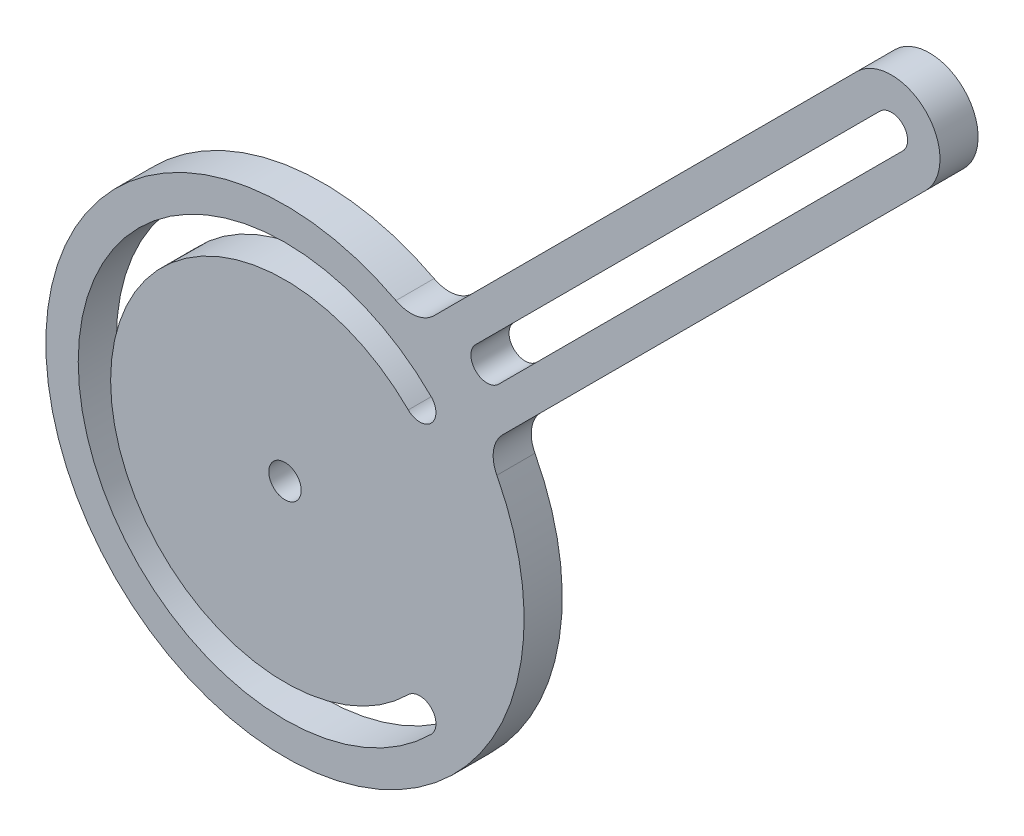
from build123d import *

# Parameters (mm, degrees)
SKETCH1_R           = 31.877
SKETCH1_R_2         = 2.159
BOSS_EXTRUDE1_DEPTH = 5.08
BOSS_EXTRUDE4_START = -5.08
BOSS_EXTRUDE4_DEPTH = 5.08
FILLET1_R           = 4.318


with BuildPart() as part:
    # Sketch1 → Boss-Extrude1 (new body)
    with BuildSketch(Plane.XY):
        Circle(SKETCH1_R)
        Circle(SKETCH1_R_2, mode=Mode.SUBTRACT)
        with BuildLine():
            ThreePointArc((19.487155783, 19.487155783), (-27.559, 0), (19.487155783, -19.487155783))
            ThreePointArc((19.487155783, -19.487155783), (19.487155783, -16.433868702), (16.433868702, -16.433868702))
            ThreePointArc((16.433868702, -16.433868702), (-23.241, 0), (16.433868702, 16.433868702))
            ThreePointArc((16.433868702, 16.433868702), (19.487155783, 16.433868702), (19.487155783, 19.487155783))
        make_face(mode=Mode.SUBTRACT)
    extrude(amount=BOSS_EXTRUDE1_DEPTH)

    # Sketch2 → Boss-Extrude4 (add)
    with BuildSketch(Plane.XY.offset(5.08).offset(BOSS_EXTRUDE4_START)):
        with BuildLine():
            Line((76.242374468, 85.402235711), (17.490316318, 26.650177562))
            ThreePointArc((17.490316318, 26.650177562), (22.540442864, 22.540442864), (26.650177562, 17.490316318))
            Line((26.650177562, 17.490316318), (85.402235711, 76.242374468))
            ThreePointArc((85.402235711, 76.242374468), (85.402235711, 85.402235711), (76.242374468, 85.402235711))
        make_face()
        with BuildLine():
            ThreePointArc((28.467411904, 25.414124823), (25.414124823, 25.414124823), (25.414124823, 28.467411904))
            Line((25.414124823, 28.467411904), (79.295661549, 82.34894863))
            ThreePointArc((79.295661549, 82.34894863), (82.34894863, 82.34894863), (82.34894863, 79.295661549))
            Line((82.34894863, 79.295661549), (28.467411904, 25.414124823))
        make_face(mode=Mode.SUBTRACT)
    extrude(amount=BOSS_EXTRUDE4_DEPTH)

    # Fillet1
    fillet1_edges = [part.edges().sort_by_distance(p)[0] for p in [
        (26.650177562, 17.490316318, 2.54),
        (17.490316318, 26.650177562, 2.54),
    ]]
    fillet(fillet1_edges, radius=FILLET1_R)


solid = part.part
